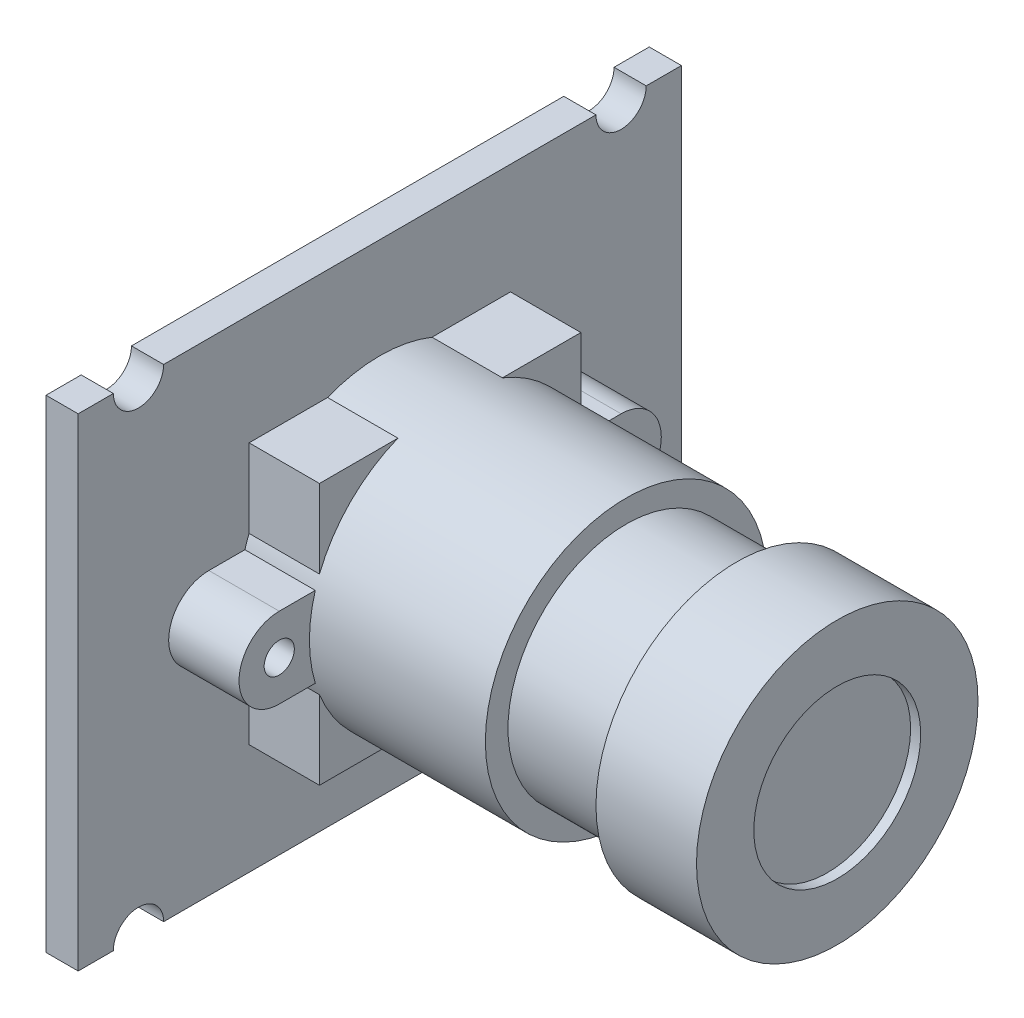
from build123d import *

# Parameters (mm, degrees)
CROQUIS_BASE_W               = 30
CROQUIS_BASE_H               = 24
PLACA_ELECTRONICA_DEPTH      = 1.6
CORTAR_EXTRUIR3_DEPTH        = 20.275891678
CROQUIS_MONTAJE_CAMARA_R     = 0.75
SALIENTE_EXTRUIR2_DEPTH      = 3.5
SALIENTE_EXTRUIR3_DEPTH      = 8.75
SALIENTE_EXTRUIR3_DEPTH_BACK = 3.5
CAMERA_STAGE_1_R             = 7
CAMERA_STAGE_2_R             = 5.875
SALIENTE_EXTRUIR4_DEPTH      = 5.5
SALIENTE_EXTRUIR5_START      = 5
CAMERA_STAGE_3_R             = 7
SALIENTE_EXTRUIR5_DEPTH      = 5
VACIADO5_START               = 1
VACIADO5_OUTLINE_R           = 5.125
VACIADO5_DEPTH               = 23.35
VACIADO5_2_OUTLINE_R         = 6
VACIADO5_2_OUTLINE_R_2       = 5.125
VACIADO5_2_DEPTH             = 11.85
VACIADO5_START_2             = 20.35
VACIADO5_3_OUTLINE_R         = 6.25
VACIADO5_3_OUTLINE_R_2       = 5.125
VACIADO5_3_DEPTH             = 4
VACIADO5_4_DEPTH             = 3.1
SALIENTE_EXTRUIR6_START      = -1.5
CROQUIS_LENTE_R              = 6.25
SALIENTE_EXTRUIR6_DEPTH      = 1.5
CROQUIS_LENTE_3_R            = 4.15
CORTAR_EXTRUIR2_DEPTH        = 1.5
SALIENTE_EXTRUIR7_START      = 0.5
CROQUIS_DEL_LENTE_R          = 4.15
SALIENTE_EXTRUIR7_DEPTH      = 0.5


# Read off the part's stored shape, not the designer's step: Vaciado5
with BuildPart() as part:
    # Croquis base → Placa electronica (new body)
    with BuildSketch(Plane(origin=(0, 0, 0), x_dir=(0, 0, -1), z_dir=(1, 0, 0))):
        Rectangle(CROQUIS_BASE_W, CROQUIS_BASE_H)
    extrude(amount=PLACA_ELECTRONICA_DEPTH)

    # Croquis barrenos → Cortar-Extruir3 (cut, through all)
    with BuildSketch(Plane(origin=(1.6, 0, 0), x_dir=(0, 0, -1), z_dir=(1, 0, 0))):
        with BuildLine():
            Line((-13.25, 12), (-10.75, 12))
            ThreePointArc((-10.75, 12), (-12, 10.75), (-13.25, 12))
        make_face()
        with BuildLine():
            Line((-13.25, -12), (-10.75, -12))
            ThreePointArc((-10.75, -12), (-12, -10.75), (-13.25, -12))
        make_face()
        with BuildLine():
            Line((10.75, 12), (13.25, 12))
            ThreePointArc((13.25, 12), (12, 10.75), (10.75, 12))
        make_face()
        with BuildLine():
            Line((10.75, -12), (13.25, -12))
            ThreePointArc((13.25, -12), (12, -10.75), (10.75, -12))
        make_face()
    extrude(amount=-CORTAR_EXTRUIR3_DEPTH, mode=Mode.SUBTRACT)

    # Croquis montaje camara → Saliente-Extruir2 (add)
    with BuildSketch(Plane(origin=(1.6, 0, 0), x_dir=(0, 0, -1), z_dir=(1, 0, 0))):
        with BuildLine():
            Line((-6.5, 6.5), (6.5, 6.5))
            Line((6.5, 6.5), (6.5, 2))
            Line((6.5, 2), (8.5, 2))
            ThreePointArc((8.5, 2), (10.5, 0), (8.5, -2))
            Line((8.5, -2), (6.5, -2))
            Line((6.5, -2), (6.5, -6.5))
            Line((6.5, -6.5), (-6.5, -6.5))
            Line((-6.5, -6.5), (-6.5, -2))
            Line((-6.5, -2), (-8.5, -2))
            ThreePointArc((-8.5, -2), (-10.5, 0), (-8.5, 2))
            Line((-8.5, 2), (-6.5, 2))
            Line((-6.5, 2), (-6.5, 6.5))
        make_face()
        with Locations((-8.5, 0)):
            Circle(CROQUIS_MONTAJE_CAMARA_R, mode=Mode.SUBTRACT)
        with Locations((8.5, 0)):
            Circle(CROQUIS_MONTAJE_CAMARA_R, mode=Mode.SUBTRACT)
    extrude(amount=SALIENTE_EXTRUIR2_DEPTH)

    # Camera Stage 1 → Saliente-Extruir3 (add, two sides: drawn at the far end of the back side and taken through both)
    with BuildSketch(Plane(origin=(5.1, 0, 0), x_dir=(0, 0, -1), z_dir=(1, 0, 0)).offset(-SALIENTE_EXTRUIR3_DEPTH_BACK)):
        Circle(CAMERA_STAGE_1_R)
    extrude(amount=SALIENTE_EXTRUIR3_DEPTH + SALIENTE_EXTRUIR3_DEPTH_BACK)

    # Camera Stage 2 → Saliente-Extruir4 (add)
    with BuildSketch(Plane(origin=(13.85, 0, 0), x_dir=(0, 0, -1), z_dir=(1, 0, 0))):
        Circle(CAMERA_STAGE_2_R)
    extrude(amount=SALIENTE_EXTRUIR4_DEPTH)

    # Camera Stage 3 → Saliente-Extruir5 (add)
    with BuildSketch(Plane(origin=(19.35, 0, 0), x_dir=(0, 0, -1), z_dir=(1, 0, 0)).offset(SALIENTE_EXTRUIR5_START)):
        Circle(CAMERA_STAGE_3_R)
    extrude(amount=-SALIENTE_EXTRUIR5_DEPTH)

    # Vaciado5 outline → Vaciado5 (cut)
    with BuildSketch(Plane.YZ.offset(VACIADO5_START)):
        Circle(VACIADO5_OUTLINE_R)
    extrude(amount=VACIADO5_DEPTH, mode=Mode.SUBTRACT)

    # Vaciado5 2 outline → Vaciado5 2 (cut)
    with BuildSketch(Plane.YZ.offset(VACIADO5_START)):
        Circle(VACIADO5_2_OUTLINE_R)
        Circle(VACIADO5_2_OUTLINE_R_2, mode=Mode.SUBTRACT)
    extrude(amount=VACIADO5_2_DEPTH, mode=Mode.SUBTRACT)

    # Vaciado5 3 outline → Vaciado5 3 (cut)
    with BuildSketch(Plane.YZ.offset(VACIADO5_START_2)):
        Circle(VACIADO5_3_OUTLINE_R)
        Circle(VACIADO5_3_OUTLINE_R_2, mode=Mode.SUBTRACT)
    extrude(amount=VACIADO5_3_DEPTH, mode=Mode.SUBTRACT)

    # Vaciado5 4 outline → Vaciado5 4 (cut)
    with BuildSketch(Plane.YZ.offset(VACIADO5_START)):
        with BuildLine():
            ThreePointArc((-1, 5.916079783), (0, 6), (1, 5.916079783))
            Line((1, 5.916079783), (1, 7.063859338))
            ThreePointArc((1, 7.063859338), (0, 6.75), (-1, 7.063859338))
            Line((-1, 7.063859338), (-1, 5.916079783))
        make_face()
        with BuildLine():
            ThreePointArc((-5.5, 2.397915762), (-4.242640687, 4.242640687), (-2.397915762, 5.5))
            Line((-2.397915762, 5.5), (-5.5, 5.5))
            Line((-5.5, 5.5), (-5.5, 2.397915762))
        make_face()
        with BuildLine():
            ThreePointArc((2.397915762, 5.5), (4.242640687, 4.242640687), (5.5, 2.397915762))
            Line((5.5, 2.397915762), (5.5, 5.5))
            Line((5.5, 5.5), (2.397915762, 5.5))
        make_face()
        with BuildLine():
            ThreePointArc((-2.397915762, -5.5), (-4.242640687, -4.242640687), (-5.5, -2.397915762))
            Line((-5.5, -2.397915762), (-5.5, -5.5))
            Line((-5.5, -5.5), (-2.397915762, -5.5))
        make_face()
        with BuildLine():
            ThreePointArc((5.5, -2.397915762), (4.242640687, -4.242640687), (2.397915762, -5.5))
            Line((2.397915762, -5.5), (5.5, -5.5))
            Line((5.5, -5.5), (5.5, -2.397915762))
        make_face()
        with BuildLine():
            ThreePointArc((1, -5.916079783), (0, -6), (-1, -5.916079783))
            Line((-1, -5.916079783), (-1, -7.063859338))
            ThreePointArc((-1, -7.063859338), (0, -6.75), (1, -7.063859338))
            Line((1, -7.063859338), (1, -5.916079783))
        make_face()
    extrude(amount=VACIADO5_4_DEPTH, mode=Mode.SUBTRACT)

    # Croquis lente → Saliente-Extruir6 (add)
    with BuildSketch(Plane(origin=(24.35, 0, 0), x_dir=(0, 0, -1), z_dir=(1, 0, 0)).offset(SALIENTE_EXTRUIR6_START)):
        Circle(CROQUIS_LENTE_R)
    extrude(amount=SALIENTE_EXTRUIR6_DEPTH)

    # Croquis lente<3> → Cortar-Extruir2 (cut)
    with BuildSketch(Plane(origin=(24.35, 0, 0), x_dir=(0, 0, -1), z_dir=(1, 0, 0))):
        Circle(CROQUIS_LENTE_3_R)
    extrude(amount=-CORTAR_EXTRUIR2_DEPTH, mode=Mode.SUBTRACT)

    # Croquis del lente → Saliente-Extruir7 (add)
    with BuildSketch(Plane(origin=(23.35, 0, 0), x_dir=(0, 0, -1), z_dir=(1, 0, 0)).offset(SALIENTE_EXTRUIR7_START)):
        Circle(CROQUIS_DEL_LENTE_R)
    extrude(amount=-SALIENTE_EXTRUIR7_DEPTH)


solid = part.part
